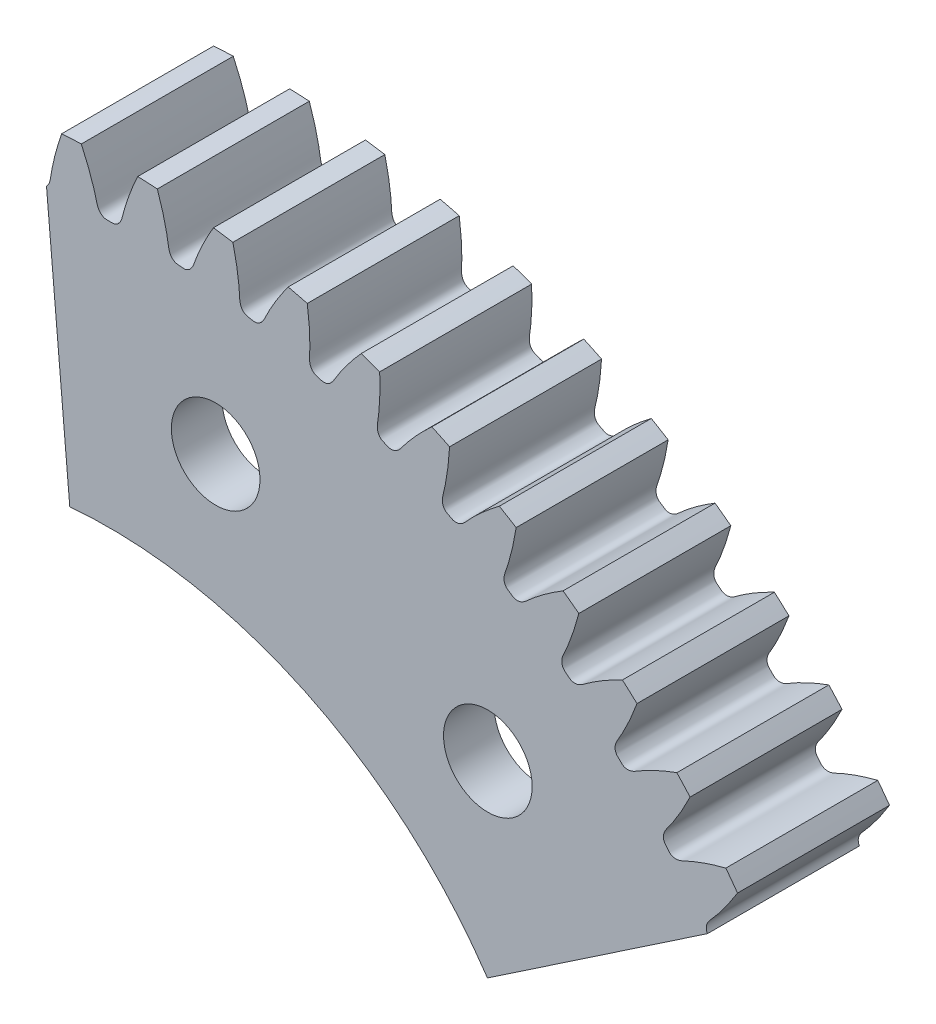
from build123d import *

# Parameters (mm, degrees)
SKETCHREVOLVESPURASSEMBLYNEW1GEAR_W       = 6
SKETCHREVOLVESPURASSEMBLYNEW1GEAR_H       = 30.5859375
TOOTHEXTRUDECUTSPURASSEMBLYNEW1GEAR_DEPTH = 4
PATTERNSPURASSEMBLYNEW1GEAR_COUNT         = 64
SKETCH_1_R                                = 1.75
CUT_EXTRUDE_1432_DEPTH                    = 44.640806331
SKETCH_2_R                                = 26.5
CUT_EXTRUDE_2642_DEPTH                    = 4


with BuildPart() as part:
    # SketchRevolveSpurAssemblyNew1Gear → SpurAssemblyNew1Gear (revolve)
    with BuildSketch(Plane(origin=(0, 0, 0), x_dir=(0, 0, -1), z_dir=(1, 0, 0))):
        with Locations((-1, 15.29296875)):
            Rectangle(SKETCHREVOLVESPURASSEMBLYNEW1GEAR_W, SKETCHREVOLVESPURASSEMBLYNEW1GEAR_H)
    revolve(axis=Axis((0, 0, 0), (0, 0, -1)))

    # SketchToothSpurAssemblyNew1Gear → ToothExtrudeCutSpurAssemblyNew1Gear (cut, symmetric)
    with BuildSketch(Plane.XY):
        with BuildLine():
            ThreePointArc((30.594491129, 1.126804494), (30.615234375, 0), (30.594491129, -1.126804494))
            add(Edge.make_bspline(
                [(30.594491129, -1.126804494), (30.513153248, -1.08876469), (30.392229292, -1.033862439), (30.232059487, -0.964523298), (30.116582931, -0.916114411), (30.004066749, -0.870473087), (29.894559131, -0.82752397), (29.788106911, -0.787190952), (29.68475557, -0.749397187), (29.584549189, -0.714065215), (29.487530555, -0.681116604), (29.393740749, -0.650473314), (29.303220551, -0.62205298), (29.216005463, -0.595785619), (29.132143126, -0.571555086), (29.051632325, -0.54940409), (28.953014436, -0.523038193), (28.872991777, -0.504974278), (28.812904254, -0.486133125), (28.791326421, -0.478779456), (28.770140086, -0.470929703), (28.749294691, -0.462524821), (28.728733016, -0.453489475), (28.708392896, -0.443727817), (28.68820819, -0.433118056), (28.668111681, -0.421505822), (28.648040322, -0.408696301), (28.627944409, -0.394445536), (28.607802663, -0.378452075), (28.587645794, -0.360351626), (28.567591022, -0.339719861), (28.547888439, -0.31609213), (28.528974517, -0.28901227), (28.511518918, -0.258123977), (28.496429245, -0.223305066), (28.484793836, -0.184833774), (28.478017662, -0.145607099), (28.474929153, -0.083645735), (28.477779142, 0), (28.474929153, 0.083645735), (28.478017662, 0.145607099), (28.484793836, 0.184833774), (28.496429245, 0.223305066), (28.511518918, 0.258123977), (28.528974517, 0.28901227), (28.547888439, 0.31609213), (28.567591022, 0.339719861), (28.587645794, 0.360351626), (28.607802663, 0.378452075), (28.627944409, 0.394445536), (28.648040322, 0.408696301), (28.668111681, 0.421505822), (28.68820819, 0.433118056), (28.708392896, 0.443727817), (28.728733016, 0.453489475), (28.749294691, 0.462524821), (28.770140086, 0.470929703), (28.791326421, 0.478779456), (28.812904254, 0.486133125), (28.872991777, 0.504974278), (28.953014436, 0.523038193), (29.051632325, 0.54940409), (29.132143126, 0.571555086), (29.216005463, 0.595785619), (29.303220551, 0.62205298), (29.393740749, 0.650473314), (29.487530555, 0.681116604), (29.584549189, 0.714065215), (29.68475557, 0.749397187), (29.788106911, 0.787190952), (29.894559131, 0.82752397), (30.004066749, 0.870473087), (30.116582931, 0.916114411), (30.232059487, 0.964523298), (30.392229292, 1.033862439), (30.513153248, 1.08876469), (30.594491129, 1.126804494)],
                knots=[0, 0, 0, 0, 0.052869434, 0.078187828, 0.102762008, 0.126591972, 0.149677722, 0.172019257, 0.193616576, 0.214469681, 0.234578571, 0.253943246, 0.272563705, 0.29043995, 0.30757198, 0.323959795, 0.339603395, 0.36768142, 0.372205404, 0.376674404, 0.381102619, 0.385506692, 0.389906194, 0.394324187, 0.398787872, 0.403329308, 0.407986154, 0.412802328, 0.417828375, 0.423121184, 0.428742439, 0.434754921, 0.441215584, 0.448164507, 0.455610022, 0.463512883, 0.471775764, 0.478976419, 0.5, 0.521023581, 0.528224236, 0.536487117, 0.544389978, 0.551835493, 0.558784416, 0.565245079, 0.571257561, 0.576878816, 0.582171625, 0.587197672, 0.592013846, 0.596670692, 0.601212128, 0.605675813, 0.610093806, 0.614493308, 0.618897381, 0.623325596, 0.627794596, 0.63231858, 0.660396605, 0.676040205, 0.69242802, 0.70956005, 0.727436295, 0.746056754, 0.765421429, 0.785530319, 0.806383424, 0.827980743, 0.850322278, 0.873408028, 0.897237992, 0.921812172, 0.947130566, 1, 1, 1, 1], degree=3))
        make_face()
    toothextrudecutspurassemblynew1gear = extrude(amount=TOOTHEXTRUDECUTSPURASSEMBLYNEW1GEAR_DEPTH, both=True, mode=Mode.SUBTRACT)

    # PatternSpurAssemblyNew1Gear: ToothExtrudeCutSpurAssemblyNew1Gear ×64 about axis
    patternspurassemblynew1gear_axis = Axis((0, 0, 50), (0, 0, -1))
    for i in range(1, PATTERNSPURASSEMBLYNEW1GEAR_COUNT):
        add(toothextrudecutspurassemblynew1gear.rotate(patternspurassemblynew1gear_axis, i * 360 / PATTERNSPURASSEMBLYNEW1GEAR_COUNT), mode=Mode.SUBTRACT)

    # Эскиз1 → Cut-Extrude 1432 (cut, through all)
    with BuildSketch(Plane.XY.offset(4)):
        with Locations((4.191417086, 22.614862874)):
            Circle(SKETCH_1_R)
        with Locations((14.937305112, 17.489337209)):
            Circle(SKETCH_1_R)
        with BuildLine():
            Line((-1.568803369, 17.931504566), (-2.817389852, 32.20291336))
            ThreePointArc((-2.817389852, 32.20291336), (-13.916668677, -29.176902636), (26.799404948, 18.076426884))
            Line((26.799404948, 18.076426884), (14.922676306, 10.065472262))
            ThreePointArc((14.922676306, 10.065472262), (7.749199743, 16.246535118), (-1.568803369, 17.931504566))
        make_face()
    extrude(amount=-CUT_EXTRUDE_1432_DEPTH, mode=Mode.SUBTRACT)

    # Эскиз2 → Cut-Extrude 2642 (cut)
    with BuildSketch(Plane.XY.offset(-2)):
        Circle(SKETCH_2_R)
    extrude(amount=CUT_EXTRUDE_2642_DEPTH, mode=Mode.SUBTRACT)


solid = part.part
